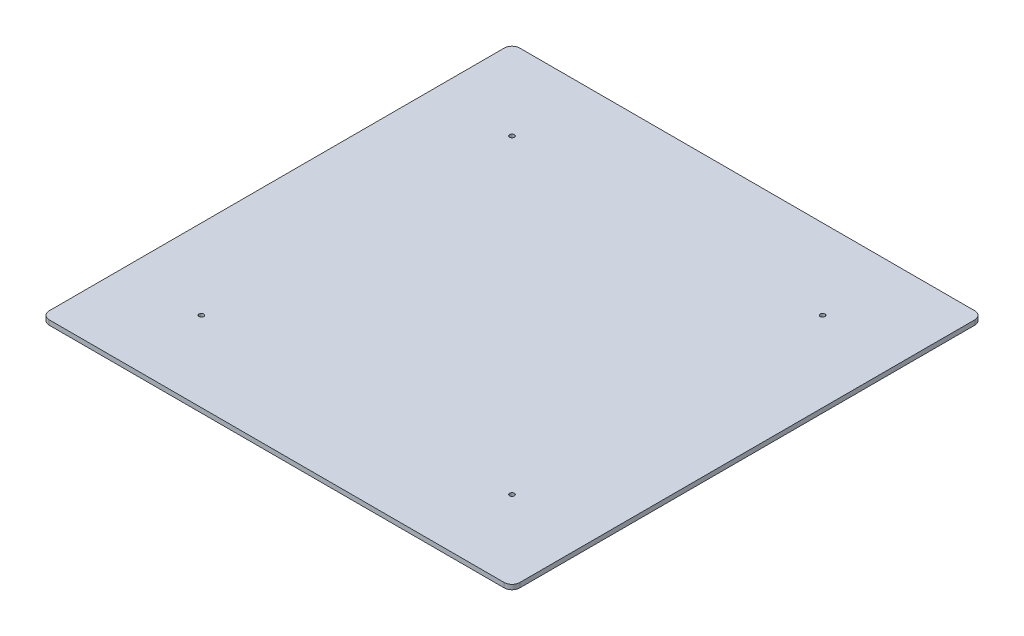
from build123d import *

# Parameters (mm, degrees)
SKETCH1_W           = 300
SKETCH1_H           = 300
SKETCH1_R           = 1.5
BOSS_EXTRUDE1_DEPTH = 3
FILLET1_R           = 5


with BuildPart() as part:
    # Sketch1 → Boss-Extrude1 (new body)
    with BuildSketch(Plane(origin=(0, 0, 0), x_dir=(1, 0, 0), z_dir=(0, 1, 0))):
        Rectangle(SKETCH1_W, SKETCH1_H)
        with Locations((-98.994949366, -98.994949366)):
            Circle(SKETCH1_R, mode=Mode.SUBTRACT)
        with Locations((-98.994949366, 98.994949366)):
            Circle(SKETCH1_R, mode=Mode.SUBTRACT)
        with Locations((98.994949366, 98.994949366)):
            Circle(SKETCH1_R, mode=Mode.SUBTRACT)
        with Locations((98.994949366, -98.994949366)):
            Circle(SKETCH1_R, mode=Mode.SUBTRACT)
    extrude(amount=BOSS_EXTRUDE1_DEPTH)

    # Fillet1
    fillet1_edges = [part.edges().sort_by_distance(p)[0] for p in [
        (150, 1.5, 150),
        (150, 1.5, -150),
        (-150, 1.5, -150),
        (-150, 1.5, 150),
    ]]
    fillet(fillet1_edges, radius=FILLET1_R)


solid = part.part
